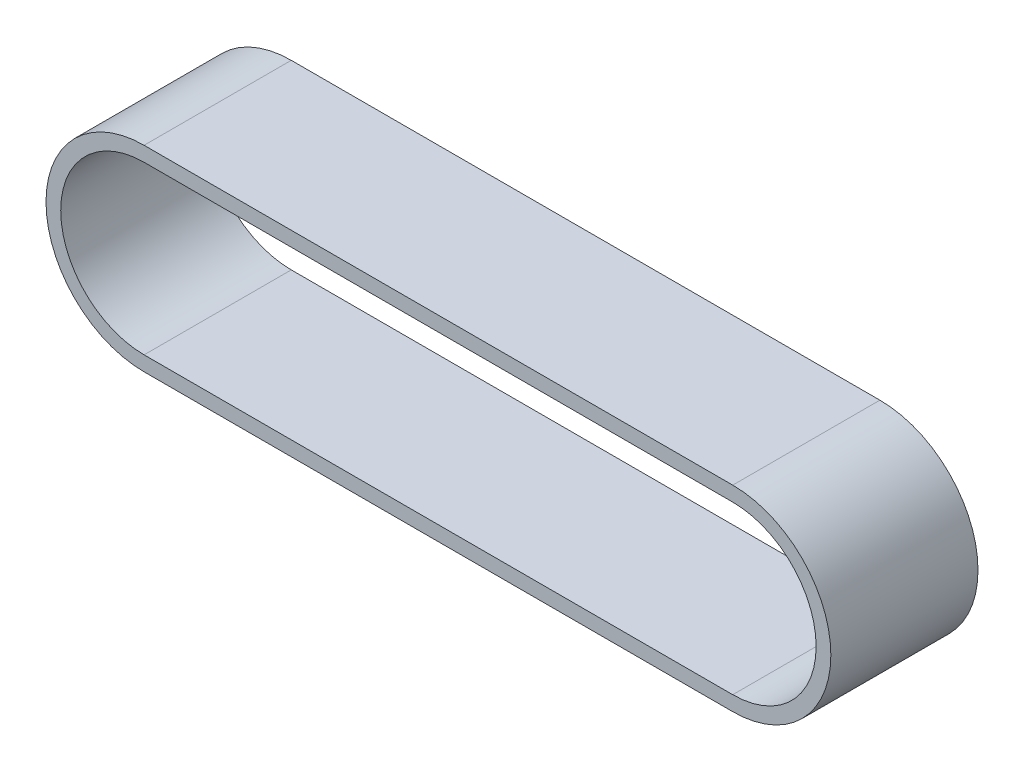
from build123d import *

# Parameters (mm, degrees)
BOSS_EXTRUDE1_DEPTH = 30


with BuildPart() as part:
    # Sketch1 → Boss-Extrude1 (new body)
    with BuildSketch(Plane.XY):
        with BuildLine():
            ThreePointArc((-60, 20), (-80, 0), (-60, -20))
            Line((-60, -20), (60, -20))
            ThreePointArc((60, -20), (80, 0), (60, 20))
            Line((60, 20), (-60, 20))
        make_face()
        with BuildLine():
            Line((-60, 17), (60, 17))
            ThreePointArc((60, 17), (77, 0), (60, -17))
            Line((60, -17), (-60, -17))
            ThreePointArc((-60, -17), (-77, 0), (-60, 17))
        make_face(mode=Mode.SUBTRACT)
    extrude(amount=BOSS_EXTRUDE1_DEPTH)


solid = part.part
